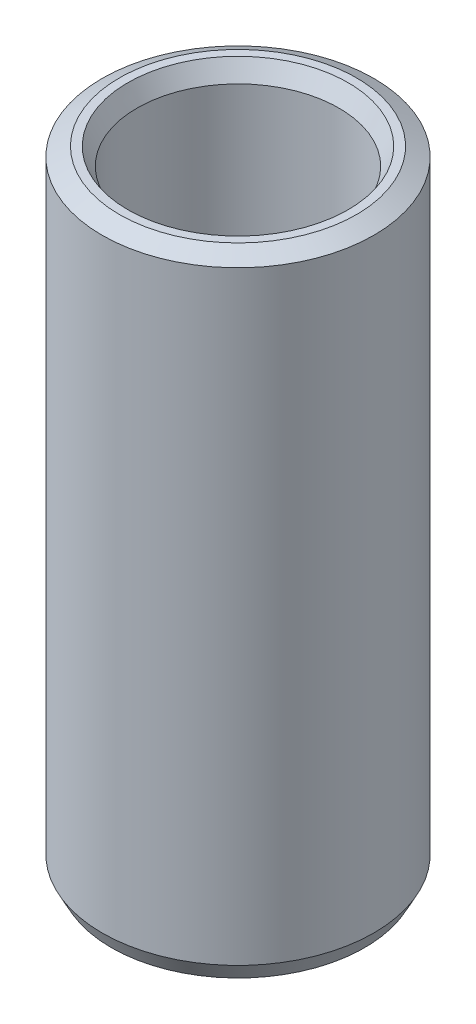
from build123d import *
from OCP.BRepFilletAPI import BRepFilletAPI_MakeChamfer

# Parameters (mm, degrees)
SKETCH1_R           = 50
BOSS_EXTRUDE1_DEPTH = 232.111634724
SKETCH2_R           = 37.135925949
CUT_EXTRUDE1_DEPTH  = 243.643382301
CHAMFER1_SIZE       = 3.386842847
CHAMFER1_SIZE2      = 6.398166009


with BuildPart() as part:
    # Sketch1 → Boss-Extrude1 (new body)
    with BuildSketch(Plane(origin=(0, 0, 0), x_dir=(1, 0, 0), z_dir=(0, 1, 0))):
        Circle(SKETCH1_R)
    extrude(amount=BOSS_EXTRUDE1_DEPTH)

    # Sketch2 → Cut-Extrude1 (cut, through all)
    with BuildSketch(Plane(origin=(0, 0, 0), x_dir=(1, 0, 0), z_dir=(0, 1, 0))):
        Circle(SKETCH2_R)
    extrude(amount=CUT_EXTRUDE1_DEPTH, mode=Mode.SUBTRACT)

    # Chamfer1: one chamfer whose edges measure the first distance from different faces: ONE call of the kernel's chamfer builder (chamfer() names one face for all edges)
    chamfer1_edges_1 = [part.edges().sort_by_distance(p)[0] for p in [
        (-37.135925949, 232.111634724, 0),
    ]]
    chamfer1_side_1 = [part.faces().sort_by_distance(p)[0] for p in [
        (-48.585786438, 232.111634724, 0),
    ]]
    chamfer1_edges_2 = [part.edges().sort_by_distance(p)[0] for p in [
        (-37.135925949, 0, 0),
    ]]
    chamfer1_side_2 = [part.faces().sort_by_distance(p)[0] for p in [
        (-37.135925949, 116.055817362, 0),
    ]]
    chamfer1_edges_3 = [part.edges().sort_by_distance(p)[0] for p in [
        (-50, 0, 0),
    ]]
    chamfer1_side_3 = [part.faces().sort_by_distance(p)[0] for p in [
        (-48.585786438, 0, 0),
    ]]
    chamfer1_edges_4 = [part.edges().sort_by_distance(p)[0] for p in [
        (-50, 232.111634724, 0),
    ]]
    chamfer1_side_4 = [part.faces().sort_by_distance(p)[0] for p in [
        (-50, 116.055817362, 0),
    ]]
    chamfer1 = BRepFilletAPI_MakeChamfer(part.part.solid().wrapped)
    for e in chamfer1_edges_1:
        chamfer1.Add(CHAMFER1_SIZE, CHAMFER1_SIZE2, e.wrapped, chamfer1_side_1[0].wrapped)  # the first distance lies on this face
    for e in chamfer1_edges_2:
        chamfer1.Add(CHAMFER1_SIZE, CHAMFER1_SIZE2, e.wrapped, chamfer1_side_2[0].wrapped)  # the first distance lies on this face
    for e in chamfer1_edges_3:
        chamfer1.Add(CHAMFER1_SIZE, CHAMFER1_SIZE2, e.wrapped, chamfer1_side_3[0].wrapped)  # the first distance lies on this face
    for e in chamfer1_edges_4:
        chamfer1.Add(CHAMFER1_SIZE, CHAMFER1_SIZE2, e.wrapped, chamfer1_side_4[0].wrapped)  # the first distance lies on this face
    add(Compound.cast(chamfer1.Shape()), mode=Mode.REPLACE)


solid = part.part
